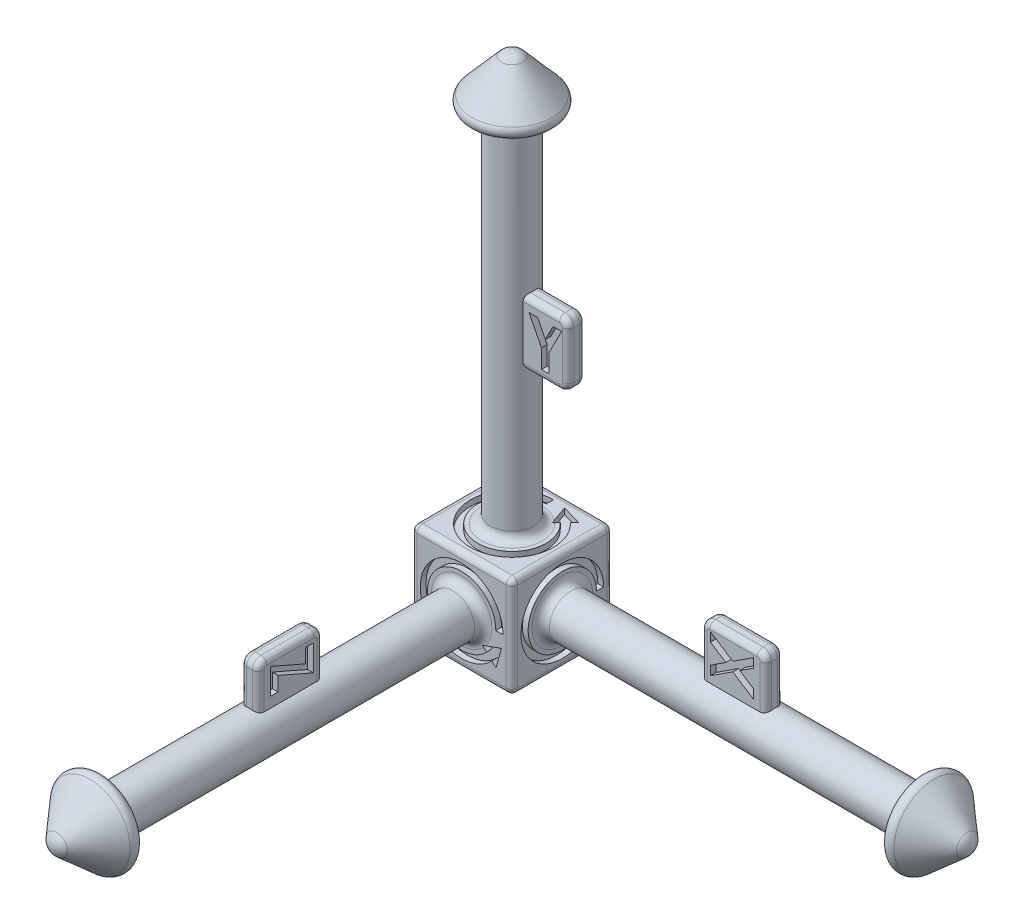
from build123d import *

# Parameters (mm, degrees)
FILLET1_R             = 1
SKETCH3_W             = 14
SKETCH3_H             = 14
BLOCK_DEPTH           = 14
X_AXIS_MATE_ANGLE     = 90
Z_AXIS_MATE_ANGLE     = 90
NEG_X_CUT_DEPTH       = 1.2
SKETCH6_W             = 9
SKETCH6_H             = 9
Y_FLAG_DEPTH          = 1.2
Y_CUT_DEPTH           = 0.8
SKETCH9_W             = 9
SKETCH9_H             = 10
X_FLAG_DEPTH          = 1.2
X_CUT_DEPTH           = 0.8
SKETCH11_W            = 9
SKETCH11_H            = 9
Z_FLAG_DEPTH          = 1.2
Z_CUT_DEPTH           = 0.8
NEG_Z_COUNT           = 2
NEG_Z_ANGLE           = 90
X_START               = -0.8
X_ROT_DEPTH           = 0.8
Y_ROT_COUNT           = 2
Y_ROT_ANGLE           = 90
Z_ROT_COUNT           = 2
Z_ROT_ANGLE           = 90
NEG_Y_COUNT           = 2
NEG_Y_ANGLE           = 90
SKETCH20_W            = 1.384615385
SKETCH20_H            = 0.666666667
NEG_X_LABEL_DEPTH     = 1.2
SKETCH21_W            = 1.384615385
SKETCH21_H            = 0.666666667
NEG_Z_LABEL_DEPTH     = 1.2
SKETCH22_W            = 0.666666667
SKETCH22_H            = 1.384615384
NEG_Y_LABEL_DEPTH     = 1.2
Y_LABEL_REVERSE_COUNT = 2
Z_LABEL_REVERSE_COUNT = 2
X_LABEL_REVERSE_COUNT = 2
FLAG_EDGE_R           = 0.8
FLAG_CORNER_R         = 1.2
CUBE_R                = 0.8
ARROWS_R              = 1.2


with BuildPart() as part:
    # Sketch1 → Y axis (revolve)
    with BuildSketch(Plane(origin=(0, 0, 0), x_dir=(0, 0, -1), z_dir=(1, 0, 0))):
        with BuildLine():
            Line((3, 50), (7, 50))
            Line((7, 50), (1.486725664, 56.300884956))
            ThreePointArc((1.486725664, 56.300884956), (0.816314478, 56.79896791), (0, 56.975513824))
            Line((0, 56.975513824), (0, 50))
            Line((0, 50), (0, 0))
            Line((0, 0), (3, 0))
            Line((3, 0), (3, 50))
        make_face()
    revolve(axis=Axis((0, 0, 0), (0, 1, 0)))

    # Fillet1
    fillet1_edges = [part.edges().sort_by_distance(p)[0] for p in [
        (0, 50, 7),
    ]]
    fillet(fillet1_edges, radius=FILLET1_R)


with BuildPart() as body_2:
    # Sketch3 → block (new body)
    with BuildSketch(Plane(origin=(0, 0, 0), x_dir=(-1, 0, 0), z_dir=(0, -1, 0))):
        Rectangle(SKETCH3_W, SKETCH3_H)
    extrude(amount=BLOCK_DEPTH)

    # Sketch5 → neg X cut (cut)
    with BuildSketch(Plane.ZY.offset(7)):
        with BuildLine():
            Line((3.464101615, -3.75), (2.880673975, -4.297368421))
            Line((2.880673975, -4.297368421), (5.539270206, -5.231106113))
            Line((5.539270206, -5.231106113), (4.776813806, -2.518421053))
            Line((4.776813806, -2.518421053), (4.193386166, -3.065789474))
            ThreePointArc((4.193386166, -3.065789474), (-5.346703211, -9.115482161), (5.75, -7))
            Line((5.75, -7), (4.75, -7))
            ThreePointArc((4.75, -7), (-4.416841783, -8.74757222), (3.464101615, -3.75))
        make_face()
    neg_x_cut = extrude(amount=-NEG_X_CUT_DEPTH, mode=Mode.SUBTRACT)


with BuildPart() as body_3:
    # X axis: copy of part
    add(part.part.moved(Location((30, 0, 0))))


with BuildPart() as body_3_1:
    # X axis mate: read off the stored shape, not the designer's step
    # X axis mate: moved
    add(body_3.part.moved(Location((-23, 7, 0))).rotate(Axis((0, 0, 0), (0, 0, -1)), X_AXIS_MATE_ANGLE))


with BuildPart() as body_4:
    # Z axis: copy of part
    add(part.part.moved(Location((30, 0, 0))))


with BuildPart() as body_4_1:
    # Z axis mate: read off the stored shape, not the designer's step
    # Z axis mate: moved
    add(body_4.part.moved(Location((-30, 7, 7))).rotate(Axis((0, 0, 0), (1, 0, 0)), Z_AXIS_MATE_ANGLE))


with BuildPart() as part_1:
    add(part.part)

    # Combine1: union body 2, body 3, body 4
    add(body_2.part)
    add(body_3_1.part)
    add(body_4_1.part)

    # Sketch6 → Y flag (add, symmetric)
    with BuildSketch(Plane.XY):
        with Locations((4.5, 25)):
            Rectangle(SKETCH6_W, SKETCH6_H)
    extrude(amount=Y_FLAG_DEPTH, both=True)

    # Sketch7 → Y cut (cut)
    with BuildSketch(Plane.XY.offset(1.2)):
        Polygon((3.567080401, 27.8), (4.765397708, 27.8), (5.83631117, 25.695432692), (6.907224632, 27.8), (8.105541939, 27.8), (6.374772708, 24.398557692), (6.374772708, 21.8), (5.297849632, 21.8), (5.297849632, 24.398557692), align=None)
    y_cut = extrude(amount=-Y_CUT_DEPTH, mode=Mode.SUBTRACT)

    # Sketch9 → X flag (add, symmetric)
    with BuildSketch(Plane.XY):
        with Locations((32, -2)):
            Rectangle(SKETCH9_W, SKETCH9_H)
    extrude(amount=X_FLAG_DEPTH, both=True)

    # Sketch10 → X cut (cut)
    with BuildSketch(Plane.XY.offset(1.2)):
        Polygon((34.8, 1.856743862), (34.8, 0.587513093), (32.873317308, -0.666092676), (34.8, -1.922102292), (34.8, -3.192534984), (31.898557692, -1.300708061), (28.8, -3.317534984), (28.8, -2.048304215), (30.925, -0.666092676), (28.8, 0.719724632), (28.8, 1.990157324), (31.899759615, -0.031477292), align=None)
    x_cut = extrude(amount=-X_CUT_DEPTH, mode=Mode.SUBTRACT)

    # Sketch11 → Z flag (add, symmetric)
    with BuildSketch(Plane(origin=(0, 0, 0), x_dir=(0, 0, -1), z_dir=(1, 0, 0))):
        with Locations((-32, -2.5)):
            Rectangle(SKETCH11_W, SKETCH11_H)
    extrude(amount=Z_FLAG_DEPTH, both=True)

    # Sketch13 → Z cut (cut)
    with BuildSketch(Plane(origin=(1.2, 0, 0), x_dir=(0, 0, -1), z_dir=(1, 0, 0))):
        Polygon((-34.8, -2.817534984), (-34.8, 0.797849632), (-29.876923077, -1.35118883), (-29.876923077, 0.644003478), (-28.8, 0.644003478), (-28.8, -2.971381138), (-33.723076923, -0.821140753), (-33.723076923, -2.817534984), align=None)
    z_cut = extrude(amount=-Z_CUT_DEPTH, mode=Mode.SUBTRACT)

    # neg Z: neg X cut ×2 about axis
    neg_z_axis = Axis((0, 0, 0), (0, -1, 0))
    for i in range(1, NEG_Z_COUNT):
        add(neg_x_cut.rotate(neg_z_axis, i * NEG_Z_ANGLE / (NEG_Z_COUNT - 1)), mode=Mode.SUBTRACT)

    # Sketch19 → X rot (cut)
    with BuildSketch(Plane(origin=(7, 0, 0), x_dir=(0, 0, -1), z_dir=(1, 0, 0)).offset(X_START)):
        with BuildLine():
            Line((4.75, -7), (5.75, -7))
            ThreePointArc((5.75, -7), (-5.346703211, -4.884517839), (4.193386166, -10.934210526))
            Line((4.193386166, -10.934210526), (4.776813806, -11.481578947))
            Line((4.776813806, -11.481578947), (5.539270206, -8.768893887))
            Line((5.539270206, -8.768893887), (2.880673975, -9.702631579))
            Line((2.880673975, -9.702631579), (3.464101615, -10.25))
            ThreePointArc((3.464101615, -10.25), (-4.416841783, -5.25242778), (4.75, -7))
        make_face()
    x_rot = extrude(amount=X_ROT_DEPTH, mode=Mode.SUBTRACT)

    # Y rot: X rot ×2 about axis
    y_rot_axis = Axis((0, -7, 0), (0, 0, 1))
    for i in range(1, Y_ROT_COUNT):
        add(x_rot.rotate(y_rot_axis, i * Y_ROT_ANGLE / (Y_ROT_COUNT - 1)), mode=Mode.SUBTRACT)

    # Z rot: X rot ×2 about axis
    z_rot_axis = Axis((0, 0, 0), (0, -1, 0))
    for i in range(1, Z_ROT_COUNT):
        add(x_rot.rotate(z_rot_axis, i * Z_ROT_ANGLE / (Z_ROT_COUNT - 1)), mode=Mode.SUBTRACT)

    # neg Y: neg X cut ×2 about axis
    neg_y_axis = Axis((0, -7, 0), (0, 0, 1))
    for i in range(1, NEG_Y_COUNT):
        add(neg_x_cut.rotate(neg_y_axis, i * NEG_Y_ANGLE / (NEG_Y_COUNT - 1)), mode=Mode.SUBTRACT)

    # Sketch20 → neg X label (cut)
    with BuildSketch(Plane.ZY.offset(7)):
        with Locations((-2.871794872, -7.538461539)):
            Rectangle(SKETCH20_W, SKETCH20_H)
        Polygon((-1.500801282, -5), (-0.654647436, -5), (0.181089744, -6.284455128), (1.018429487, -5), (1.865384615, -5), (0.604166667, -6.934294872), (1.948717949, -9), (1.102564103, -9), (0.181089744, -7.583333333), (-0.742788462, -9), (-1.58974359, -9), (-0.241987179, -6.93349359), align=None)
    extrude(amount=-NEG_X_LABEL_DEPTH, mode=Mode.SUBTRACT)

    # Sketch21 → neg Z label (cut)
    with BuildSketch(Plane(origin=(0, 0, -7), x_dir=(-1, 0, 0), z_dir=(0, 0, -1))):
        with Locations((-2.384615384, -7.538461539)):
            Rectangle(SKETCH21_W, SKETCH21_H)
        Polygon((-0.974358974, -5), (1.435897436, -5), (0.003205128, -8.282051282), (1.333333333, -8.282051282), (1.333333333, -9), (-1.076923077, -9), (0.356570513, -5.717948718), (-0.974358974, -5.717948718), align=None)
    extrude(amount=-NEG_Z_LABEL_DEPTH, mode=Mode.SUBTRACT)

    # Sketch22 → neg Y label (cut)
    with BuildSketch(Plane(origin=(0, -14, 0), x_dir=(-1, 0, 0), z_dir=(0, -1, 0))):
        with Locations((0.538461539, -2.717948718)):
            Rectangle(SKETCH22_W, SKETCH22_H)
        Polygon((-2, -1.435897436), (-2, -0.637019231), (-0.596955128, 0.076923077), (-2, 0.790865385), (-2, 1.58974359), (0.267628205, 0.435897436), (2, 0.435897436), (2, -0.282051282), (0.267628205, -0.282051282), align=None)
    extrude(amount=-NEG_Y_LABEL_DEPTH, mode=Mode.SUBTRACT)

    # y label reverse: Y cut ×2 about axis
    y_label_reverse_axis = Axis((5.874772708, 0, 0), (0, 1, 0))
    for i in range(1, Y_LABEL_REVERSE_COUNT):
        add(y_cut.rotate(y_label_reverse_axis, i * 360 / Y_LABEL_REVERSE_COUNT), mode=Mode.SUBTRACT)

    # Z label reverse: Z cut ×2 about axis
    z_label_reverse_axis = Axis((0, -1.125227292, 0), (0, 0, 1))
    for i in range(1, Z_LABEL_REVERSE_COUNT):
        add(z_cut.rotate(z_label_reverse_axis, i * 360 / Z_LABEL_REVERSE_COUNT), mode=Mode.SUBTRACT)

    # X label reverse: X cut ×2 about axis
    x_label_reverse_axis = Axis((0, -0.625227292, 0), (1, 0, 0))
    for i in range(1, X_LABEL_REVERSE_COUNT):
        add(x_cut.rotate(x_label_reverse_axis, i * 360 / X_LABEL_REVERSE_COUNT), mode=Mode.SUBTRACT)

    # flag edge
    flag_edge_edges = [part_1.edges().sort_by_distance(p)[0] for p in [
        (27.5, -0.625227292, 1.2),
        (-1.2, -1.125227292, 36.5),
        (-1.2, -1.125227292, 27.5),
        (-1.2, 2, 32),
        (1.2, -1.125227292, 27.5),
        (1.2, 2, 32),
        (1.2, -1.125227292, 36.5),
        (5.874772708, 20.5, -1.2),
        (9, 25, -1.2),
        (5.874772708, 29.5, -1.2),
        (5.874772708, 20.5, 1.2),
        (9, 25, 1.2),
        (5.874772708, 29.5, 1.2),
        (27.5, -0.625227292, -1.2),
        (36.5, -0.625227292, -1.2),
        (32, 3, -1.2),
        (36.5, -0.625227292, 1.2),
        (32, 3, 1.2),
    ]]
    fillet(flag_edge_edges, radius=FLAG_EDGE_R)

    # flag corner
    # the kernel refuses this fillet: 1.2 mm, written as the material it takes off along each edge
    with BuildSketch(Plane(origin=(7.8, 21.7, -1.2), x_dir=(1, 0, 0), z_dir=(0, 1, 0))) as flag_corner_piece_1:
        with BuildLine():
            CenterArc((0.4, -0.8), 0.8, 0, 90)
            Line((1.2, -0.8), (1.2, 0))
            Line((1.2, 0), (0.4, 0))
        make_face()
    revolve(axis=Axis((7.8, 21.7, -1.2), (0, 0, -1)), revolution_arc=90, mode=Mode.SUBTRACT)
    with BuildSketch(Plane(origin=(7.8, 28.3, -1.2), x_dir=(0, 1, 0), z_dir=(-1, 0, 0))) as flag_corner_piece_2:
        with BuildLine():
            CenterArc((0.4, -0.8), 0.8, 0, 90)
            Line((1.2, -0.8), (1.2, 0))
            Line((1.2, 0), (0.4, 0))
        make_face()
    revolve(axis=Axis((7.8, 28.3, -1.2), (0, 0, -1)), revolution_arc=90, mode=Mode.SUBTRACT)
    with BuildSketch(Plane(origin=(-1.2, 0.8, 28.7), x_dir=(0, 1, 0), z_dir=(0, 0, 1))) as flag_corner_piece_3:
        with BuildLine():
            CenterArc((0.4, -0.8), 0.8, 0, 90)
            Line((1.2, -0.8), (1.2, 0))
            Line((1.2, 0), (0.4, 0))
        make_face()
    revolve(axis=Axis((-1.2, 0.8, 28.7), (-1, 0, 0)), revolution_arc=90, mode=Mode.SUBTRACT)
    with BuildSketch(Plane(origin=(-1.2, 0.8, 35.3), x_dir=(0, 0, 1), z_dir=(0, -1, 0))) as flag_corner_piece_4:
        with BuildLine():
            CenterArc((0.4, -0.8), 0.8, 0, 90)
            Line((1.2, -0.8), (1.2, 0))
            Line((1.2, 0), (0.4, 0))
        make_face()
    revolve(axis=Axis((-1.2, 0.8, 35.3), (-1, 0, 0)), revolution_arc=90, mode=Mode.SUBTRACT)
    with BuildSketch(Plane(origin=(1.2, 0.8, 35.3), x_dir=(0, 1, 0), z_dir=(0, 0, -1))) as flag_corner_piece_5:
        with BuildLine():
            CenterArc((0.4, -0.8), 0.8, 0, 90)
            Line((1.2, -0.8), (1.2, 0))
            Line((1.2, 0), (0.4, 0))
        make_face()
    revolve(axis=Axis((1.2, 0.8, 35.3), (1, 0, 0)), revolution_arc=90, mode=Mode.SUBTRACT)
    with BuildSketch(Plane(origin=(1.2, 0.8, 28.7), x_dir=(0, 1.4400332778071367e-12, -1.0), z_dir=(0, -1.0, -1.4400332778071367e-12))) as flag_corner_piece_6:
        with BuildLine():
            CenterArc((0.4, -0.8), 0.8, 0, 90)
            Line((1.2, -0.8), (1.2, 0))
            Line((1.2, 0), (0.4, 0))
        make_face()
    revolve(axis=Axis((1.2, 0.8, 28.7), (1, 0, 0)), revolution_arc=90, mode=Mode.SUBTRACT)
    with BuildSketch(Plane(origin=(7.8, 21.7, 1.2), x_dir=(0, -1, 0), z_dir=(-1, 0, 0))) as flag_corner_piece_7:
        with BuildLine():
            CenterArc((0.4, -0.8), 0.8, 0, 90)
            Line((1.2, -0.8), (1.2, 0))
            Line((1.2, 0), (0.4, 0))
        make_face()
    revolve(axis=Axis((7.8, 21.7, 1.2), (0, 0, 1)), revolution_arc=90, mode=Mode.SUBTRACT)
    with BuildSketch(Plane(origin=(7.8, 28.3, 1.2), x_dir=(1, 0, 0), z_dir=(0, -1, 0))) as flag_corner_piece_8:
        with BuildLine():
            CenterArc((0.4, -0.8), 0.8, 0, 90)
            Line((1.2, -0.8), (1.2, 0))
            Line((1.2, 0), (0.4, 0))
        make_face()
    revolve(axis=Axis((7.8, 28.3, 1.2), (0, 0, 1)), revolution_arc=90, mode=Mode.SUBTRACT)
    with BuildSketch(Plane(origin=(35.3, 1.8, 1.2), x_dir=(1, 0, 0), z_dir=(0, -1, 0))) as flag_corner_piece_9:
        with BuildLine():
            CenterArc((0.4, -0.8), 0.8, 0, 90)
            Line((1.2, -0.8), (1.2, 0))
            Line((1.2, 0), (0.4, 0))
        make_face()
    revolve(axis=Axis((35.3, 1.8, 1.2), (0, 0, 1)), revolution_arc=90, mode=Mode.SUBTRACT)
    with BuildSketch(Plane(origin=(28.7, 1.8, 1.2), x_dir=(0, 1, 0), z_dir=(1, 0, 0))) as flag_corner_piece_10:
        with BuildLine():
            CenterArc((0.4, -0.8), 0.8, 0, 90)
            Line((1.2, -0.8), (1.2, 0))
            Line((1.2, 0), (0.4, 0))
        make_face()
    revolve(axis=Axis((28.7, 1.8, 1.2), (0, 0, 1)), revolution_arc=90, mode=Mode.SUBTRACT)
    with BuildSketch(Plane(origin=(35.3, 1.8, -1.2), x_dir=(0, 1, 0), z_dir=(-1, 0, 0))) as flag_corner_piece_11:
        with BuildLine():
            CenterArc((0.4, -0.8), 0.8, 0, 90)
            Line((1.2, -0.8), (1.2, 0))
            Line((1.2, 0), (0.4, 0))
        make_face()
    revolve(axis=Axis((35.3, 1.8, -1.2), (0, 0, -1)), revolution_arc=90, mode=Mode.SUBTRACT)
    with BuildSketch(Plane(origin=(28.7, 1.8, -1.2), x_dir=(-1, 0, 0), z_dir=(0, -1, 0))) as flag_corner_piece_12:
        with BuildLine():
            CenterArc((0.4, -0.8), 0.8, 0, 90)
            Line((1.2, -0.8), (1.2, 0))
            Line((1.2, 0), (0.4, 0))
        make_face()
    revolve(axis=Axis((28.7, 1.8, -1.2), (0, 0, -1)), revolution_arc=90, mode=Mode.SUBTRACT)
    with BuildSketch(Plane(origin=(9, 29.5, -1.2), x_dir=(-1, 0, 0), z_dir=(0, 0, 1))) as flag_corner_piece_13:
        with BuildLine():
            CenterArc((FLAG_CORNER_R, FLAG_CORNER_R), FLAG_CORNER_R, 180, 90)
            Line((0, FLAG_CORNER_R), (0, 0))
            Line((0, 0), (FLAG_CORNER_R, 0))
        make_face()
    extrude(amount=2.4, mode=Mode.SUBTRACT)
    with BuildSketch(Plane(origin=(9, 20.5, -1.2), x_dir=(-1, 0, 0), z_dir=(0, 0, 1)), Plane(origin=(1.2, 2, 36.5), x_dir=(0, -1, 0), z_dir=(-1, 0, 0)), Plane(origin=(-1.2, 2, 27.5), x_dir=(0, -1.0, -1.4388490399162743e-12), z_dir=(1, 0, 0)), Plane(origin=(27.5, 3, 1.2), x_dir=(0, -1, 0), z_dir=(0, 0, -1)), Plane(origin=(36.5, 3, -1.2), x_dir=(0, -1, 0), z_dir=(0, 0, 1))) as flag_corner_piece_14:
        with BuildLine():
            CenterArc((FLAG_CORNER_R, -FLAG_CORNER_R), FLAG_CORNER_R, 90, 90)
            Line((0, -FLAG_CORNER_R), (0, 0))
            Line((0, 0), (FLAG_CORNER_R, 0))
        make_face()
    extrude(amount=2.4, mode=Mode.SUBTRACT)

    # cube
    cube_edges = [part_1.edges().sort_by_distance(p)[0] for p in [
        (7, 0, 0),
        (7, -7, -7),
        (0, 0, 7),
        (7, -7, 7),
        (-7, 0, 0),
        (-7, -7, 7),
        (0, 0, -7),
        (-7, -7, -7),
        (7, -14, 0),
        (0, -14, 7),
        (-7, -14, 0),
        (0, -14, -7),
    ]]
    fillet(cube_edges, radius=CUBE_R)

    # arrows
    # the kernel refuses this fillet: 1.2 mm, written as the material it adds along each edge
    with BuildSketch(Plane(origin=(7, -7, 0), x_dir=(0, 0, -1), z_dir=(0, -1, 0))) as arrows_piece_1_section:
        with BuildLine():
            CenterArc((3 + ARROWS_R, ARROWS_R), ARROWS_R, 180, 90)
            Line((3, ARROWS_R), (3, 0))
            Line((3, 0), (3 + ARROWS_R, 0))
        make_face()
    arrows_piece_1 = revolve(axis=Axis((7, -7, 0), (1, 0, 0)), mode=Mode.PRIVATE)
    arrows_piece_1 = split(arrows_piece_1, bisect_by=Plane(origin=(7, -7, 0), z_dir=(0, 0.7292845505553172, -0.684210526315789)), keep=Keep.TOP, mode=Mode.PRIVATE)
    arrows_piece_1 = split(arrows_piece_1, bisect_by=Plane(origin=(7, -10.3065035, -1.161292155), z_dir=(0, 0.9435004977183524, 0.33137110737845166)), keep=Keep.TOP, mode=Mode.PRIVATE)
    add(arrows_piece_1)
    with BuildSketch(Plane(origin=(7, -7, 0), x_dir=(0, 0, -1), z_dir=(0, -1, 0))) as arrows_piece_2_section:
        with BuildLine():
            CenterArc((3 + ARROWS_R, ARROWS_R), ARROWS_R, 180, 90)
            Line((3, ARROWS_R), (3, 0))
            Line((3, 0), (3 + ARROWS_R, 0))
        make_face()
    arrows_piece_2 = revolve(axis=Axis((7, -7, 0), (1, 0, 0)), mode=Mode.PRIVATE)
    arrows_piece_2 = split(arrows_piece_2, bisect_by=Plane(origin=(7, -7, 0), z_dir=(0, -0.7292845505553172, 0.684210526315789)), keep=Keep.TOP, mode=Mode.PRIVATE)
    arrows_piece_2 = split(arrows_piece_2, bisect_by=Plane(origin=(7, -10.3065035, -1.161292155), z_dir=(0, 0.9435004977183524, 0.33137110737845166)), keep=Keep.TOP, mode=Mode.PRIVATE)
    add(arrows_piece_2)
    with BuildSketch(Plane(origin=(7, -7, 0), x_dir=(0, 0, -1), z_dir=(0, -1, 0))) as arrows_piece_3_section:
        with BuildLine():
            CenterArc((3 + ARROWS_R, ARROWS_R), ARROWS_R, 180, 90)
            Line((3, ARROWS_R), (3, 0))
            Line((3, 0), (3 + ARROWS_R, 0))
        make_face()
    arrows_piece_3 = revolve(axis=Axis((7, -7, 0), (1, 0, 0)), mode=Mode.PRIVATE)
    arrows_piece_3 = split(arrows_piece_3, bisect_by=Plane(origin=(7, -7, 0), z_dir=(0, -0.7292845505553172, 0.684210526315789)), keep=Keep.TOP, mode=Mode.PRIVATE)
    arrows_piece_3 = split(arrows_piece_3, bisect_by=Plane(origin=(7, -10.3065035, -1.161292155), z_dir=(0, -0.9435004977183524, -0.33137110737845166)), keep=Keep.TOP, mode=Mode.PRIVATE)
    add(arrows_piece_3)
    with BuildSketch(Plane(origin=(0, -7, 7), x_dir=(0, 1, 0), z_dir=(1, 0, 0))) as arrows_piece_4_section:
        with BuildLine():
            CenterArc((3 + ARROWS_R, ARROWS_R), ARROWS_R, 180, 90)
            Line((3, ARROWS_R), (3, 0))
            Line((3, 0), (3 + ARROWS_R, 0))
        make_face()
    arrows_piece_4 = revolve(axis=Axis((0, -7, 7), (0, 0, 1)), mode=Mode.PRIVATE)
    arrows_piece_4 = split(arrows_piece_4, bisect_by=Plane(origin=(0, -7, 7), z_dir=(0.684210526315789, 0.7292845505553172, 2.430804096021394e-15)), keep=Keep.TOP, mode=Mode.PRIVATE)
    arrows_piece_4 = split(arrows_piece_4, bisect_by=Plane(origin=(1.161292155, -10.3065035, 7), z_dir=(-0.33137110737845166, 0.9435004977183524, -1.1772666659426948e-15)), keep=Keep.TOP, mode=Mode.PRIVATE)
    add(arrows_piece_4)
    with BuildSketch(Plane(origin=(0, -7, 7), x_dir=(0, 1, 0), z_dir=(1, 0, 0))) as arrows_piece_5_section:
        with BuildLine():
            CenterArc((3 + ARROWS_R, ARROWS_R), ARROWS_R, 180, 90)
            Line((3, ARROWS_R), (3, 0))
            Line((3, 0), (3 + ARROWS_R, 0))
        make_face()
    arrows_piece_5 = revolve(axis=Axis((0, -7, 7), (0, 0, 1)), mode=Mode.PRIVATE)
    arrows_piece_5 = split(arrows_piece_5, bisect_by=Plane(origin=(0, -7, 7), z_dir=(-0.684210526315789, -0.7292845505553172, -2.430804096021394e-15)), keep=Keep.TOP, mode=Mode.PRIVATE)
    arrows_piece_5 = split(arrows_piece_5, bisect_by=Plane(origin=(1.161292155, -10.3065035, 7), z_dir=(-0.33137110737845166, 0.9435004977183524, -1.1772666659426948e-15)), keep=Keep.TOP, mode=Mode.PRIVATE)
    add(arrows_piece_5)
    with BuildSketch(Plane(origin=(0, -7, 7), x_dir=(0, 1, 0), z_dir=(1, 0, 0))) as arrows_piece_6_section:
        with BuildLine():
            CenterArc((3 + ARROWS_R, ARROWS_R), ARROWS_R, 180, 90)
            Line((3, ARROWS_R), (3, 0))
            Line((3, 0), (3 + ARROWS_R, 0))
        make_face()
    arrows_piece_6 = revolve(axis=Axis((0, -7, 7), (0, 0, 1)), mode=Mode.PRIVATE)
    arrows_piece_6 = split(arrows_piece_6, bisect_by=Plane(origin=(0, -7, 7), z_dir=(-0.684210526315789, -0.7292845505553172, -2.430804096021394e-15)), keep=Keep.TOP, mode=Mode.PRIVATE)
    arrows_piece_6 = split(arrows_piece_6, bisect_by=Plane(origin=(1.161292155, -10.3065035, 7), z_dir=(0.33137110737845166, -0.9435004977183524, 1.1772666659426948e-15)), keep=Keep.TOP, mode=Mode.PRIVATE)
    add(arrows_piece_6)
    with BuildSketch(Plane(origin=(0, 0, 0), x_dir=(0, 0, -1), z_dir=(1, 0, 0))) as arrows_piece_7_section:
        with BuildLine():
            CenterArc((3 + ARROWS_R, ARROWS_R), ARROWS_R, 180, 90)
            Line((3, ARROWS_R), (3, 0))
            Line((3, 0), (3 + ARROWS_R, 0))
        make_face()
    arrows_piece_7 = revolve(axis=Axis((0, 0, 0), (0, 1, 0)), mode=Mode.PRIVATE)
    arrows_piece_7 = split(arrows_piece_7, bisect_by=Plane(origin=(0, 0, 0), z_dir=(-0.7292845505553172, -2.5909391984957507e-15, -0.684210526315789)), keep=Keep.TOP, mode=Mode.PRIVATE)
    arrows_piece_7 = split(arrows_piece_7, bisect_by=Plane(origin=(3.3065035, 0, -1.161292155), z_dir=(-0.9435004977183524, -3.3519871241990715e-15, 0.33137110737845166)), keep=Keep.TOP, mode=Mode.PRIVATE)
    add(arrows_piece_7)
    with BuildSketch(Plane(origin=(0, 0, 0), x_dir=(0, 0, -1), z_dir=(1, 0, 0))) as arrows_piece_8_section:
        with BuildLine():
            CenterArc((3 + ARROWS_R, ARROWS_R), ARROWS_R, 180, 90)
            Line((3, ARROWS_R), (3, 0))
            Line((3, 0), (3 + ARROWS_R, 0))
        make_face()
    arrows_piece_8 = revolve(axis=Axis((0, 0, 0), (0, 1, 0)), mode=Mode.PRIVATE)
    arrows_piece_8 = split(arrows_piece_8, bisect_by=Plane(origin=(0, 0, 0), z_dir=(0.7292845505553172, 2.5909391984957507e-15, 0.684210526315789)), keep=Keep.TOP, mode=Mode.PRIVATE)
    arrows_piece_8 = split(arrows_piece_8, bisect_by=Plane(origin=(3.3065035, 0, -1.161292155), z_dir=(-0.9435004977183524, -3.3519871241990715e-15, 0.33137110737845166)), keep=Keep.TOP, mode=Mode.PRIVATE)
    add(arrows_piece_8)
    with BuildSketch(Plane(origin=(0, 0, 0), x_dir=(0, 0, -1), z_dir=(1, 0, 0))) as arrows_piece_9_section:
        with BuildLine():
            CenterArc((3 + ARROWS_R, ARROWS_R), ARROWS_R, 180, 90)
            Line((3, ARROWS_R), (3, 0))
            Line((3, 0), (3 + ARROWS_R, 0))
        make_face()
    arrows_piece_9 = revolve(axis=Axis((0, 0, 0), (0, 1, 0)), mode=Mode.PRIVATE)
    arrows_piece_9 = split(arrows_piece_9, bisect_by=Plane(origin=(0, 0, 0), z_dir=(0.7292845505553172, 2.5909391984957507e-15, 0.684210526315789)), keep=Keep.TOP, mode=Mode.PRIVATE)
    arrows_piece_9 = split(arrows_piece_9, bisect_by=Plane(origin=(3.3065035, 0, -1.161292155), z_dir=(0.9435004977183524, 3.3519871241990715e-15, -0.33137110737845166)), keep=Keep.TOP, mode=Mode.PRIVATE)
    add(arrows_piece_9)


solid = part_1.part
